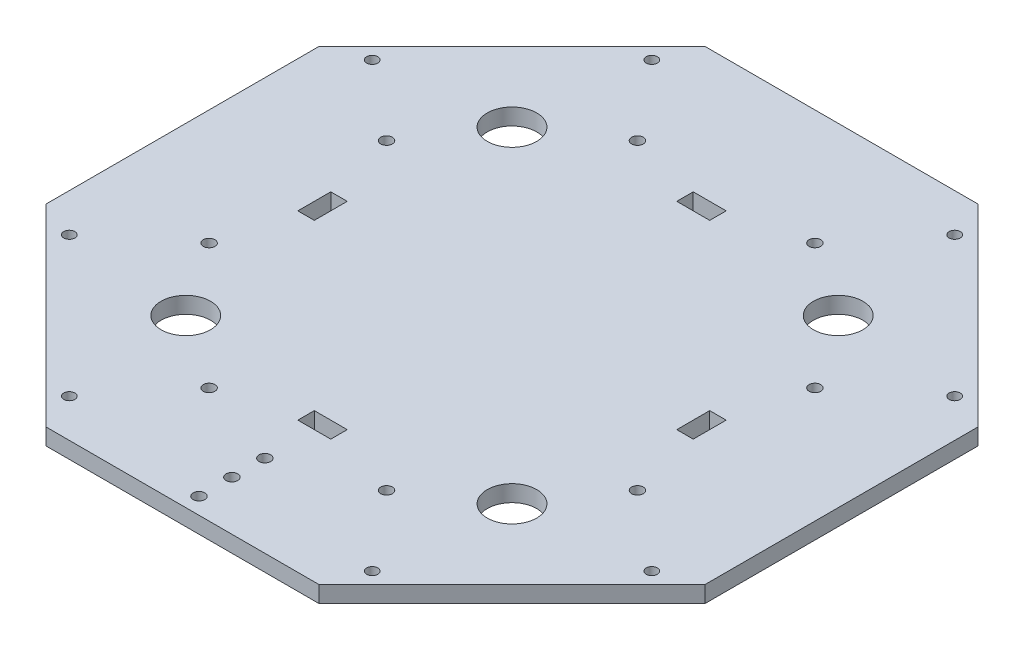
from build123d import *

# Parameters (mm, degrees)
BASE_DEPTH                   = 6.35
SUPPORT_CUTOUTS_REACH        = 181.717
SKETCH4_W                    = 12.7
SKETCH4_H                    = 6.35
SUPPORT_CUTOUT_PATTERN_COUNT = 4
F_8_CLEARANCE_HOLE1_D        = 4.4958
CABLE_HOLES_REACH            = 181.717
SKETCH14_R                   = 9.525
F_8_CLEARANCE_HOLE2_D        = 4.4958
PLATE_MOUNTING_HOLES_D       = 4.3053
CIRPATTERN1_COUNT            = 4


with BuildPart() as part:
    # Base sketch → Base (new body)
    with BuildSketch(Plane(origin=(0, 0, 0), x_dir=(1, 0, 0), z_dir=(0, 1, 0))):
        Polygon((-127, 52.605122421), (-127, -52.605122421), (-52.605122421, -127), (52.605122421, -127), (127, -52.605122421), (127, 52.605122421), (52.605122421, 127), (-52.605122421, 127), align=None)
    extrude(amount=BASE_DEPTH)

    # Sketch4 → Support cutouts (cut, up to next)
    with BuildSketch(Plane(origin=(0, 6.35, 0), x_dir=(1, 0, 0), z_dir=(0, 1, 0)), mode=Mode.PRIVATE) as support_cutouts_sk1:
        with Locations((0, 73.025)):
            Rectangle(SKETCH4_W, SKETCH4_H)
    support_cutouts_tool1 = extrude(support_cutouts_sk1.sketch, amount=-SUPPORT_CUTOUTS_REACH, mode=Mode.PRIVATE) & part.part
    support_cutouts = support_cutouts_tool1.solids().sort_by_distance((0, 6.35, -73.025))[0]
    add(support_cutouts, mode=Mode.SUBTRACT)

    # Support cutout pattern: Support cutouts ×4 about axis
    support_cutout_pattern_axis = Axis((0, -0.29972, 0), (0, 1, 0))
    for i in range(1, SUPPORT_CUTOUT_PATTERN_COUNT):
        add(support_cutouts.rotate(support_cutout_pattern_axis, i * 360 / SUPPORT_CUTOUT_PATTERN_COUNT), mode=Mode.SUBTRACT)

    # #8 Clearance Hole1 (through all)
    with Locations(Plane(origin=(0, 6.35, 0), x_dir=(1, 0, 0), z_dir=(0, 1, 0))):
        with Locations((-82.55, 34.193329574), (-34.193329574, 82.55), (34.193329574, 82.55), (82.55, 34.193329574), (82.55, -34.193329574), (34.193329574, -82.55), (-34.193329574, -82.55), (-82.55, -34.193329574)):
            Hole(F_8_CLEARANCE_HOLE1_D / 2)

    # Sketch14 → Cable holes (cut, up to next)
    with BuildSketch(Plane(origin=(0, 6.35, 0), x_dir=(1, 0, 0), z_dir=(0, 1, 0)), mode=Mode.PRIVATE) as cable_holes_sk1:
        with Locations((-62.861792847, 62.861792847)):
            Circle(SKETCH14_R)
    cable_holes_tool1 = extrude(cable_holes_sk1.sketch, amount=-CABLE_HOLES_REACH, mode=Mode.PRIVATE) & part.part
    # Sketch14 → Cable holes (cut, up to next)
    with BuildSketch(Plane(origin=(0, 6.35, 0), x_dir=(1, 0, 0), z_dir=(0, 1, 0)), mode=Mode.PRIVATE) as cable_holes_sk2:
        with Locations((62.861792847, 62.861792847)):
            Circle(SKETCH14_R)
    cable_holes_tool2 = extrude(cable_holes_sk2.sketch, amount=-CABLE_HOLES_REACH, mode=Mode.PRIVATE) & part.part
    # Sketch14 → Cable holes (cut, up to next)
    with BuildSketch(Plane(origin=(0, 6.35, 0), x_dir=(1, 0, 0), z_dir=(0, 1, 0)), mode=Mode.PRIVATE) as cable_holes_sk3:
        with Locations((62.861792847, -62.861792847)):
            Circle(SKETCH14_R)
    cable_holes_tool3 = extrude(cable_holes_sk3.sketch, amount=-CABLE_HOLES_REACH, mode=Mode.PRIVATE) & part.part
    # Sketch14 → Cable holes (cut, up to next)
    with BuildSketch(Plane(origin=(0, 6.35, 0), x_dir=(1, 0, 0), z_dir=(0, 1, 0)), mode=Mode.PRIVATE) as cable_holes_sk4:
        with Locations((-62.861792847, -62.861792847)):
            Circle(SKETCH14_R)
    cable_holes_tool4 = extrude(cable_holes_sk4.sketch, amount=-CABLE_HOLES_REACH, mode=Mode.PRIVATE) & part.part
    add(cable_holes_tool1.solids().sort_by_distance((-62.861793, 6.35, -62.861793))[0], mode=Mode.SUBTRACT)
    add(cable_holes_tool2.solids().sort_by_distance((62.861793, 6.35, -62.861793))[0], mode=Mode.SUBTRACT)
    add(cable_holes_tool3.solids().sort_by_distance((62.861793, 6.35, 62.861793))[0], mode=Mode.SUBTRACT)
    add(cable_holes_tool4.solids().sort_by_distance((-62.861793, 6.35, 62.861793))[0], mode=Mode.SUBTRACT)

    # #8 Clearance Hole2 (through all)
    with Locations(Plane(origin=(0, 6.35, 0), x_dir=(1, 0, 0), z_dir=(0, 1, 0))):
        with Locations((0, -120.65), (0, -107.95), (0, -95.25)):
            Hole(F_8_CLEARANCE_HOLE2_D / 2)

    # plate mounting holes (through all)
    with Locations(Plane(origin=(0, 6.35, 0), x_dir=(1, 0, 0), z_dir=(0, 1, 0))):
        with Locations((112.253201513, 58.371664787), (58.371664787, 112.253201513)):
            plate_mounting_holes = Hole(PLATE_MOUNTING_HOLES_D / 2)

    # CirPattern1: plate mounting holes ×4 about axis
    cirpattern1_axis = Axis((0, -0.29972, 0), (0, 1, 0))
    for i in range(1, CIRPATTERN1_COUNT):
        add(plate_mounting_holes.rotate(cirpattern1_axis, i * 360 / CIRPATTERN1_COUNT), mode=Mode.SUBTRACT)


solid = part.part
